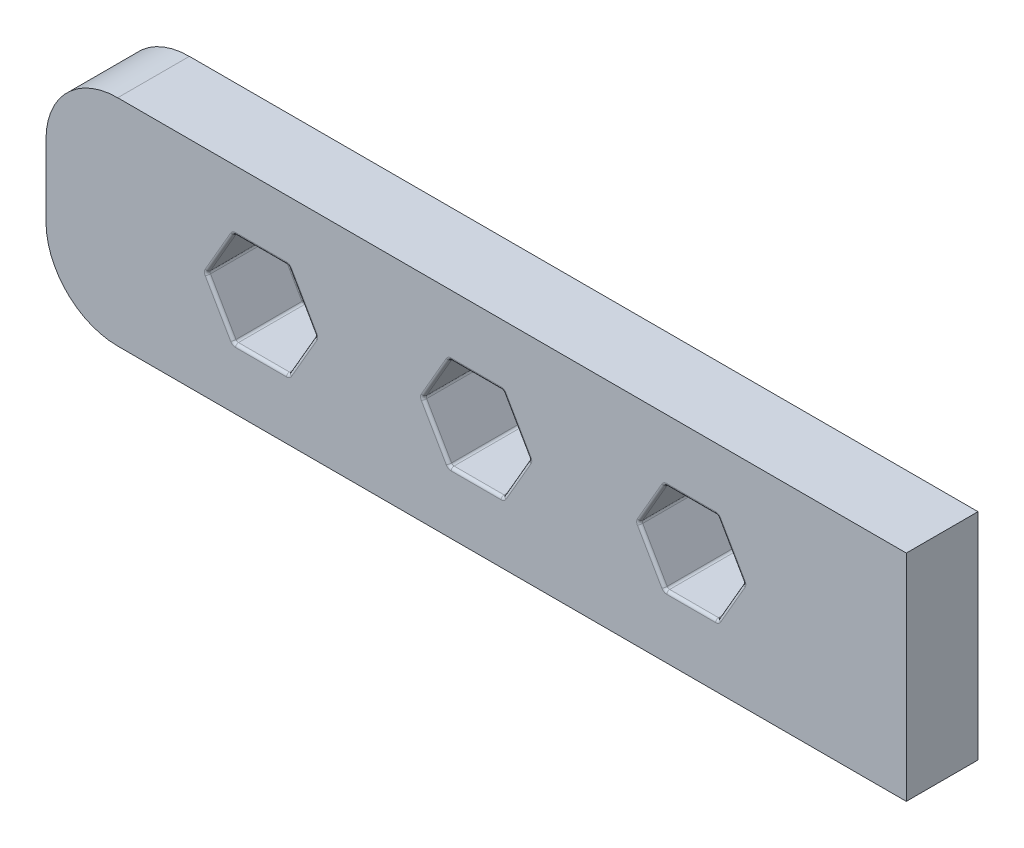
from build123d import *

# Parameters (mm, degrees)
BOSS_EXTRUDE1_DEPTH = 5
CUT_EXTRUDE3_DEPTH  = 5
FILLET1_R           = 0.2


with BuildPart() as part:
    # Sketch1 → Boss-Extrude1 (new body)
    with BuildSketch(Plane.XY):
        with BuildLine():
            Line((-25, -7.5), (30, -7.5))
            Line((30, -7.5), (30, 7.5))
            Line((30, 7.5), (-25, 7.5))
            ThreePointArc((-25, 7.5), (-28.535533906, 6.035533906), (-30, 2.5))
            Line((-30, 2.5), (-30, -2.5))
            ThreePointArc((-30, -2.5), (-28.535533906, -6.035533906), (-25, -7.5))
        make_face()
    extrude(amount=BOSS_EXTRUDE1_DEPTH)

    # Sketch2 → Cut-Extrude3 (cut)
    with BuildSketch(Plane.XY):
        Polygon((-11.218355737, 0), (-13.109177868, 3.275), (-16.890822132, 3.275), (-18.781644263, 0), (-16.890822132, -3.275), (-13.109177868, -3.275), align=None)
        Polygon((3.70947548, 0), (1.85473774, 3.2125), (-1.85473774, 3.2125), (-3.70947548, 0), (-1.85473774, -3.2125), (1.85473774, -3.2125), align=None)
        Polygon((18.637306696, 0), (16.818653348, 3.15), (13.181346652, 3.15), (11.362693304, 0), (13.181346652, -3.15), (16.818653348, -3.15), align=None)
    extrude(amount=CUT_EXTRUDE3_DEPTH, mode=Mode.SUBTRACT)

    # Fillet1
    fillet1_edges = [part.edges().sort_by_distance(p)[0] for p in [
        (15, 3.15, 5),
        (15, 3.15, 0),
        (17.727980022, -1.575, 5),
        (17.727980022, -1.575, 0),
        (12.272019978, -1.575, 5),
        (12.272019978, -1.575, 0),
        (0, 3.2125, 5),
        (0, 3.2125, 0),
        (2.78210661, -1.60625, 5),
        (2.78210661, -1.60625, 0),
        (-2.78210661, -1.60625, 5),
        (-2.78210661, -1.60625, 0),
        (-15, 3.275, 5),
        (-15, 3.275, 0),
        (-12.163766803, -1.6375, 5),
        (-12.163766803, -1.6375, 0),
        (-17.836233197, -1.6375, 5),
        (-17.836233197, -1.6375, 0),
        (11.362693304, 0, 2.5),
        (12.272019978, 1.575, 5),
        (13.181346652, 3.15, 2.5),
        (12.272019978, 1.575, 0),
        (16.818653348, 3.15, 2.5),
        (17.727980022, 1.575, 5),
        (18.637306696, 0, 2.5),
        (17.727980022, 1.575, 0),
        (16.818653348, -3.15, 2.5),
        (15, -3.15, 5),
        (13.181346652, -3.15, 2.5),
        (15, -3.15, 0),
        (-3.70947548, 0, 2.5),
        (-2.78210661, 1.60625, 5),
        (-1.85473774, 3.2125, 2.5),
        (-2.78210661, 1.60625, 0),
        (1.85473774, 3.2125, 2.5),
        (2.78210661, 1.60625, 5),
        (3.70947548, 0, 2.5),
        (2.78210661, 1.60625, 0),
        (1.85473774, -3.2125, 2.5),
        (0, -3.2125, 5),
        (-1.85473774, -3.2125, 2.5),
        (0, -3.2125, 0),
        (-18.781644263, 0, 2.5),
        (-17.836233197, 1.6375, 5),
        (-16.890822132, 3.275, 2.5),
        (-17.836233197, 1.6375, 0),
        (-13.109177868, 3.275, 2.5),
        (-12.163766803, 1.6375, 5),
        (-11.218355737, 0, 2.5),
        (-12.163766803, 1.6375, 0),
        (-13.109177868, -3.275, 2.5),
        (-15, -3.275, 5),
        (-16.890822132, -3.275, 2.5),
        (-15, -3.275, 0),
    ]]
    fillet(fillet1_edges, radius=FILLET1_R)


solid = part.part
